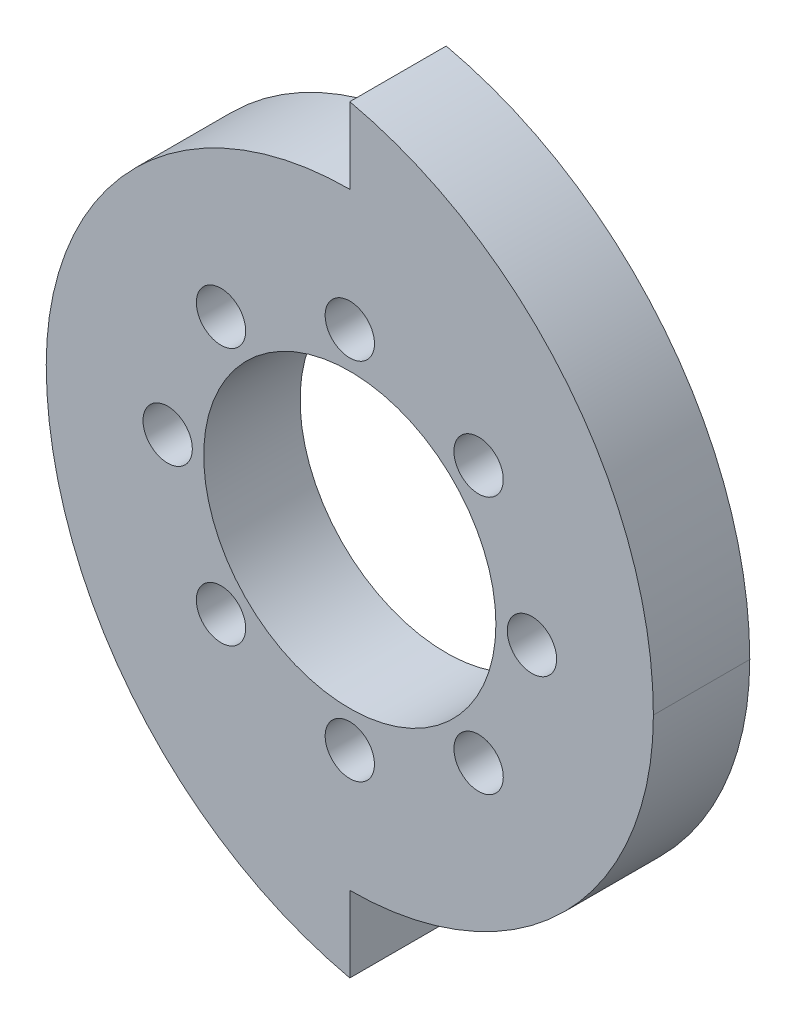
from build123d import *

# Parameters (mm, degrees)
BOSS_EXTRUDE1_DEPTH = 6.35
SKETCH4_R           = 9.625
SKETCH4_R_2         = 1.625
CUT_EXTRUDE1_DEPTH  = 33.639278485
CIRPATTERN1_COUNT   = 8


with BuildPart() as part:
    # Sketch3 → Boss-Extrude1 (new body)
    with BuildSketch(Plane.XY):
        with BuildLine():
            Line((0, 20), (0, 25))
            ThreePointArc((0, 25), (14.384763242, 16.007810594), (20, 0))
            ThreePointArc((20, 0), (14.142135624, -14.142135624), (0, -20))
            Line((0, -20), (0, -25))
            ThreePointArc((0, -25), (-14.384763242, -16.007810594), (-20, 0))
            ThreePointArc((-20, 0), (-14.142135624, 14.142135624), (0, 20))
        make_face()
    extrude(amount=BOSS_EXTRUDE1_DEPTH)

    # Sketch4 → Cut-Extrude1 (cut, through all)
    with BuildSketch(Plane.XY.offset(6.35)):
        Circle(SKETCH4_R)
        with Locations((0, 12)):
            Circle(SKETCH4_R_2)
    cut_extrude1 = extrude(amount=-CUT_EXTRUDE1_DEPTH, mode=Mode.SUBTRACT)

    # CirPattern1: Cut-Extrude1 ×8 about axis
    cirpattern1_axis = Axis((0, 0, -0.475), (0, 0, 1))
    for i in range(1, CIRPATTERN1_COUNT):
        add(cut_extrude1.rotate(cirpattern1_axis, i * 360 / CIRPATTERN1_COUNT), mode=Mode.SUBTRACT)


solid = part.part
